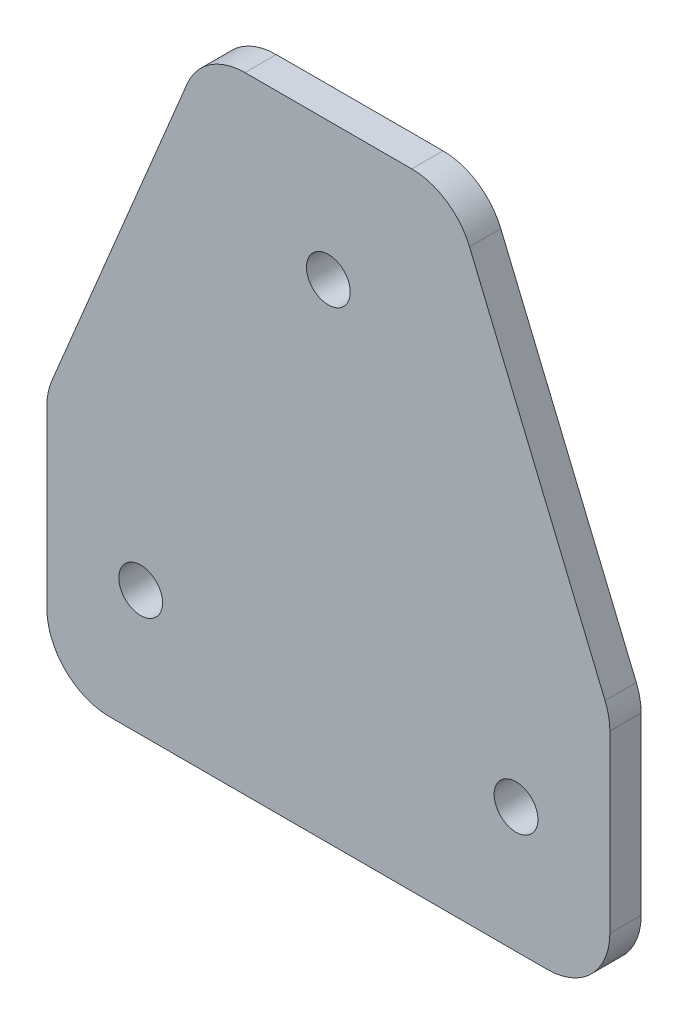
from build123d import *

# Parameters (mm, degrees)
BOSS_EXTRU_1_DEPTH           = 5
ENL_V_MAT_EXTRU_1_DEPTH      = 135.629120178
ENL_V_MAT_EXTRU_1_DEPTH_BACK = 135.629120178
ESQUISSE2_R                  = 3.5
CONG_1_R                     = 10


with BuildPart() as part:
    # Esquisse1 → Boss.-Extru.1 (new body)
    with BuildSketch(Plane.XY):
        Polygon((90, 0), (90, 40), (65, 100), (25, 100), (0, 40), (0, 0), align=None)
    extrude(amount=BOSS_EXTRU_1_DEPTH)

    # Esquisse2 → Enlèv. mat.-Extru.1 (cut, two sides: drawn at the far end of the back side and taken through both)
    with BuildSketch(Plane.XY.offset(5).offset(-ENL_V_MAT_EXTRU_1_DEPTH_BACK)):
        with Locations((15, 20)):
            Circle(ESQUISSE2_R)
        with Locations((75, 20)):
            Circle(ESQUISSE2_R)
        with Locations((45, 78)):
            Circle(ESQUISSE2_R)
    extrude(amount=ENL_V_MAT_EXTRU_1_DEPTH + ENL_V_MAT_EXTRU_1_DEPTH_BACK, mode=Mode.SUBTRACT)

    # Congé1
    cong_1_edges = [part.edges().sort_by_distance(p)[0] for p in [
        (25, 100, 2.5),
        (65, 100, 2.5),
        (90, 40, 2.5),
        (90, 0, 2.5),
        (0, 0, 2.5),
        (0, 40, 2.5),
    ]]
    fillet(cong_1_edges, radius=CONG_1_R)


solid = part.part
